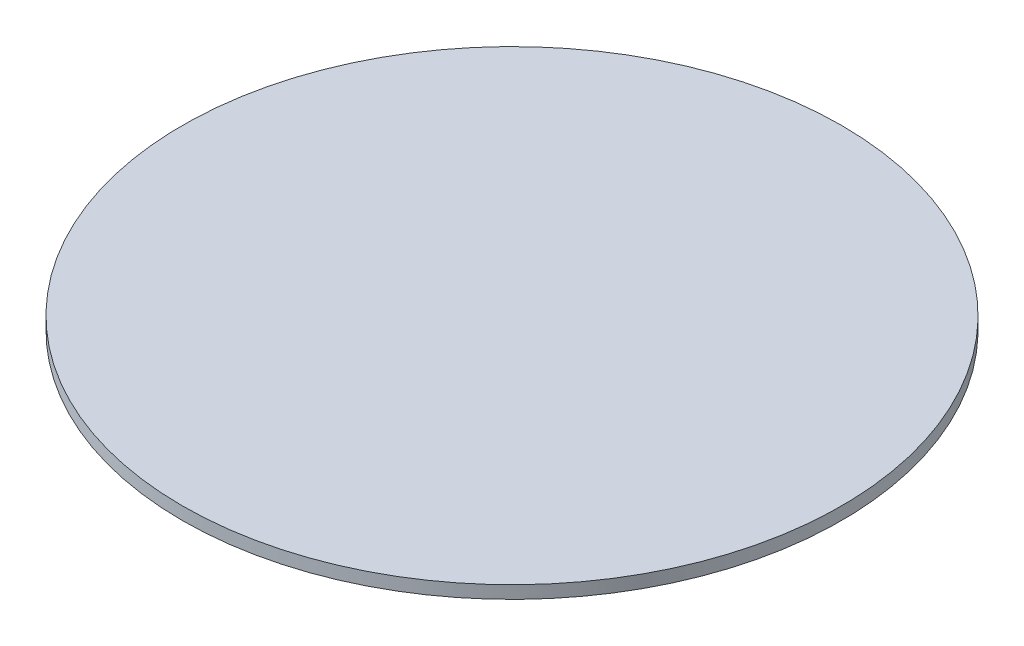
from build123d import *

# Parameters (mm, degrees)
SKETCH1_R           = 65.769791736
BOSS_EXTRUDE1_DEPTH = 2.54


with BuildPart() as part:
    # Sketch1 → Boss-Extrude1 (new body)
    with BuildSketch(Plane(origin=(0, 0, 0), x_dir=(1, 0, 0), z_dir=(0, 1, 0))):
        Circle(SKETCH1_R)
    extrude(amount=BOSS_EXTRUDE1_DEPTH)


solid = part.part
